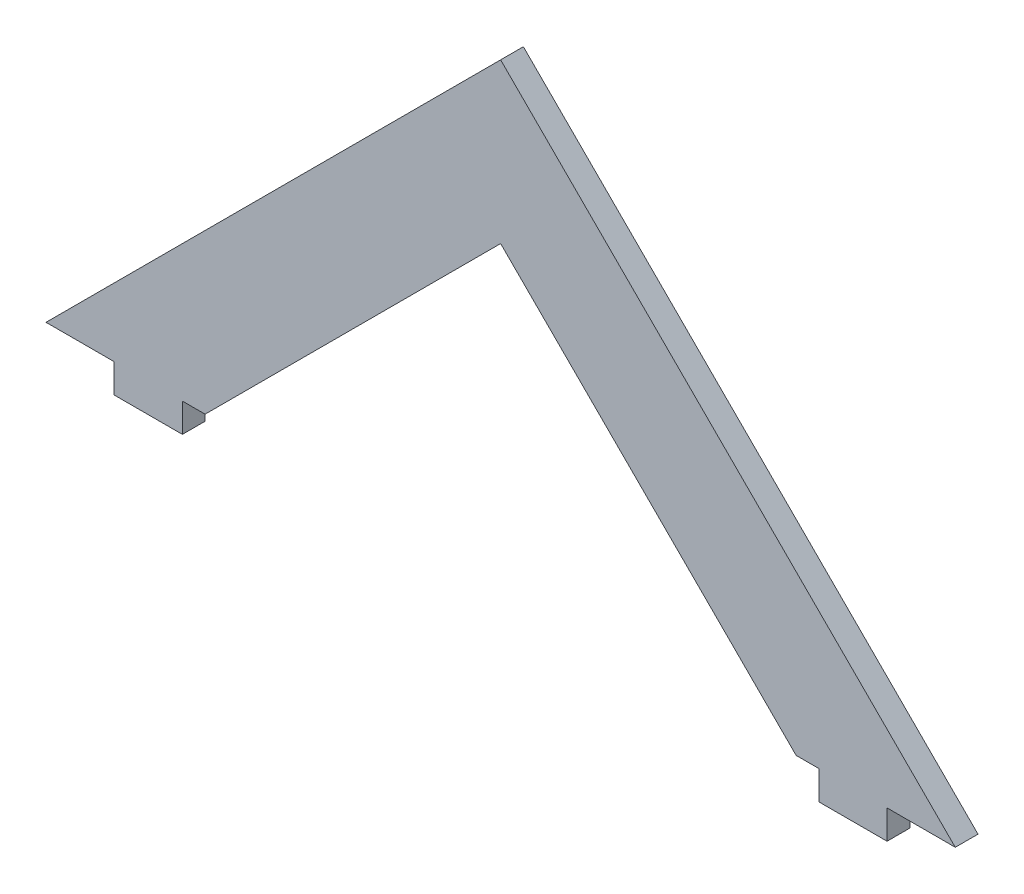
from build123d import *

# Parameters (mm, degrees)
BOSS_EXTRUDE1_DEPTH = 5


with BuildPart() as part:
    # Sketch1 → Boss-Extrude1 (new body)
    with BuildSketch(Plane.XY):
        Polygon((30, 0), (15, 0), (15, 6.35), (0, 6.35), (100, 106.35), (200, 6.35), (185, 6.35), (185, 0), (170, 0), (170, 6.35), (165, 6.35), (100, 71.35), (35, 6.35), (30, 6.35), align=None)
    extrude(amount=BOSS_EXTRUDE1_DEPTH)


solid = part.part
